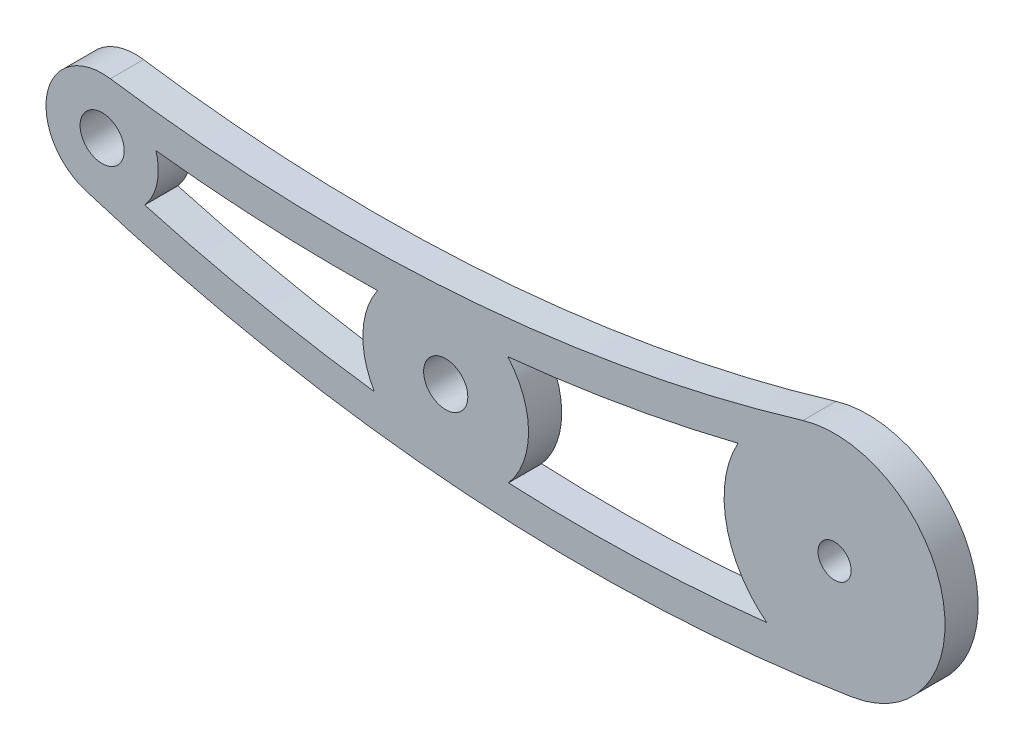
from build123d import *

# Parameters (mm, degrees)
SKETCH1_R           = 2
SKETCH1_R_2         = 1.5
EXTRUDE1_DEPTH      = 3
BOSS_EXTRUDE1_START = -3
SKETCH2_R           = 2
SKETCH2_R_2         = 1.5
BOSS_EXTRUDE1_DEPTH = 3
CUT_EXTRUDE1_START  = -5
CUT_EXTRUDE1_DEPTH  = 5


with BuildPart() as part:
    # Sketch1 → Extrude1 (new body)
    with BuildSketch(Plane.XY):
        with BuildLine():
            ThreePointArc((-2.193092226, -4.586072393), (33.15, -8), (68.493092226, -4.586072393))
            ThreePointArc((68.493092226, -4.586072393), (71.132119564, 1.578712775), (65.362424897, 4.996265248))
            ThreePointArc((65.362424897, 4.996265248), (33.150000007, 2), (0.937575117, 4.996265246))
            ThreePointArc((0.937575117, 4.996265246), (-4.832119562, 1.578712782), (-2.193092226, -4.586072393))
        make_face()
        Circle(SKETCH1_R, mode=Mode.SUBTRACT)
        with Locations((31.1, -3.74)):
            Circle(SKETCH1_R, mode=Mode.SUBTRACT)
        with Locations((66.3, 0)):
            Circle(SKETCH1_R_2, mode=Mode.SUBTRACT)
    extrude(amount=EXTRUDE1_DEPTH)

    # Sketch2 → Boss-Extrude1 (add)
    with BuildSketch(Plane.XY.offset(3).offset(BOSS_EXTRUDE1_START)):
        with BuildLine():
            ThreePointArc((-1.523614168, -4.849774569), (32.891650058, -11.40834478), (67.892593326, -9.872367826))
            ThreePointArc((67.892593326, -9.872367826), (76.046454518, 2.23754873), (63.427158085, 9.578453911))
            ThreePointArc((63.427158085, 9.578453911), (32.334608499, 3.858874967), (0.742030741, 5.029026137))
            ThreePointArc((0.742030741, 5.029026137), (-4.954835417, 1.136362396), (-1.523614168, -4.849774569))
        make_face()
        with Locations((31.1, -3.74)):
            Circle(SKETCH2_R, mode=Mode.SUBTRACT)
        Circle(SKETCH2_R, mode=Mode.SUBTRACT)
        with Locations((66.3, 0)):
            Circle(SKETCH2_R_2, mode=Mode.SUBTRACT)
    extrude(amount=BOSS_EXTRUDE1_DEPTH)

    # Sketch3 → Cut-Extrude1 (cut)
    with BuildSketch(Plane.XY.offset(3).offset(CUT_EXTRUDE1_START)):
        with BuildLine():
            ThreePointArc((4.86926369, 1.460131712), (4.972034413, -1.058577959), (3.852185168, -3.316984011))
            ThreePointArc((3.852185168, -3.316984011), (14.172697484, -5.810622174), (24.645226339, -7.559148726))
            ThreePointArc((24.645226339, -7.559148726), (23.604378321, -3.483766436), (24.921100593, 0.511023655))
            ThreePointArc((24.921100593, 0.511023655), (14.879037339, 0.644485923), (4.86926369, 1.460131712))
        make_face()
        with BuildLine():
            ThreePointArc((36.718188813, 1.228496198), (38.599846278, -3.691981225), (36.781348534, -8.636149389))
            ThreePointArc((36.781348534, -8.636149389), (48.487966367, -8.728733859), (60.165384794, -7.897246119))
            ThreePointArc((60.165384794, -7.897246119), (56.502324822, -2.001389793), (57.559699529, 4.858718728))
            ThreePointArc((57.559699529, 4.858718728), (47.20402982, 2.669943525), (36.718188813, 1.228496198))
        make_face()
    extrude(amount=CUT_EXTRUDE1_DEPTH, mode=Mode.SUBTRACT)


solid = part.part
